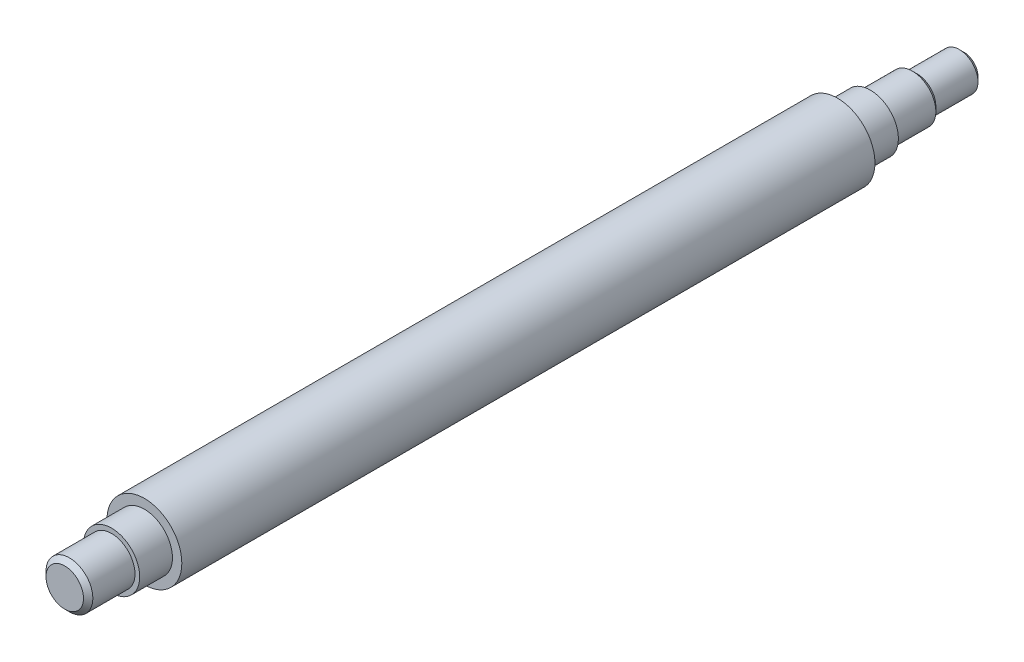
from build123d import *

# Parameters (mm, degrees)
SKETCH1_R           = 8
BOSS_EXTRUDE1_DEPTH = 148
SKETCH6_R           = 6
BOSS_EXTRUDE2_DEPTH = 5
SKETCH7_R           = 6
BOSS_EXTRUDE3_DEPTH = 2
SKETCH8_R           = 5
BOSS_EXTRUDE4_DEPTH = 10
SKETCH9_R           = 4
BOSS_EXTRUDE5_DEPTH = 10
CHAMFER1_SIZE       = 1
CHAMFER2_SIZE       = 1
BOSS_EXTRUDE6_START = 5
SKETCH10_R          = 6
BOSS_EXTRUDE6_DEPTH = 5
BOSS_EXTRUDE7_START = 2
SKETCH11_R          = 6
BOSS_EXTRUDE7_DEPTH = 2
BOSS_EXTRUDE8_START = 10
SKETCH12_R          = 5
BOSS_EXTRUDE8_DEPTH = 10
CHAMFER3_SIZE       = 1


with BuildPart() as part:
    # Sketch1 → Boss-Extrude1 (new body)
    with BuildSketch(Plane.XY):
        Circle(SKETCH1_R)
    extrude(amount=BOSS_EXTRUDE1_DEPTH)

    # Sketch6 → Boss-Extrude2 (add)
    with BuildSketch(Plane(origin=(0, 0, 0), x_dir=(-1, 0, 0), z_dir=(0, 0, -1))):
        with Locations(Location((0, 0, 0), (0, 0, 180))):
            Circle(SKETCH6_R)
    extrude(amount=BOSS_EXTRUDE2_DEPTH)

    # Sketch7 → Boss-Extrude3 (add)
    with BuildSketch(Plane(origin=(0, 0, -5), x_dir=(-1, 0, 0), z_dir=(0, 0, -1))):
        with Locations(Location((0, 0, 0), (0, 0, 180))):
            Circle(SKETCH7_R)
    extrude(amount=BOSS_EXTRUDE3_DEPTH)

    # Sketch8 → Boss-Extrude4 (add)
    with BuildSketch(Plane(origin=(0, 0, -7), x_dir=(-1, 0, 0), z_dir=(0, 0, -1))):
        Circle(SKETCH8_R)
    extrude(amount=BOSS_EXTRUDE4_DEPTH)

    # Sketch9 → Boss-Extrude5 (add)
    with BuildSketch(Plane(origin=(0, 0, -17), x_dir=(-1, 0, 0), z_dir=(0, 0, -1))):
        Circle(SKETCH9_R)
    extrude(amount=BOSS_EXTRUDE5_DEPTH)

    # Chamfer1
    chamfer1_edges = [part.edges().sort_by_distance(p)[0] for p in [
        (5, 0, -17),
    ]]
    chamfer(chamfer1_edges, length=CHAMFER1_SIZE - 0.0001)  # a hair under: the kernel refuses the full size

    # Chamfer2
    chamfer2_edges = [part.edges().sort_by_distance(p)[0] for p in [
        (4, 0, -27),
    ]]
    chamfer(chamfer2_edges, length=CHAMFER2_SIZE)

    # Sketch10 → Boss-Extrude6 (add)
    with BuildSketch(Plane.XY.offset(148).offset(BOSS_EXTRUDE6_START)):
        Circle(SKETCH10_R)
    extrude(amount=-BOSS_EXTRUDE6_DEPTH)

    # Sketch11 → Boss-Extrude7 (add)
    with BuildSketch(Plane.XY.offset(153).offset(BOSS_EXTRUDE7_START)):
        Circle(SKETCH11_R)
    extrude(amount=-BOSS_EXTRUDE7_DEPTH)

    # Sketch12 → Boss-Extrude8 (add)
    with BuildSketch(Plane.XY.offset(155).offset(BOSS_EXTRUDE8_START)):
        with Locations(Location((0, 0, 0), (0, 0, 180))):
            Circle(SKETCH12_R)
    extrude(amount=-BOSS_EXTRUDE8_DEPTH)

    # Chamfer3
    chamfer3_edges = [part.edges().sort_by_distance(p)[0] for p in [
        (5, 0, 165),
    ]]
    chamfer(chamfer3_edges, length=CHAMFER3_SIZE)


solid = part.part
